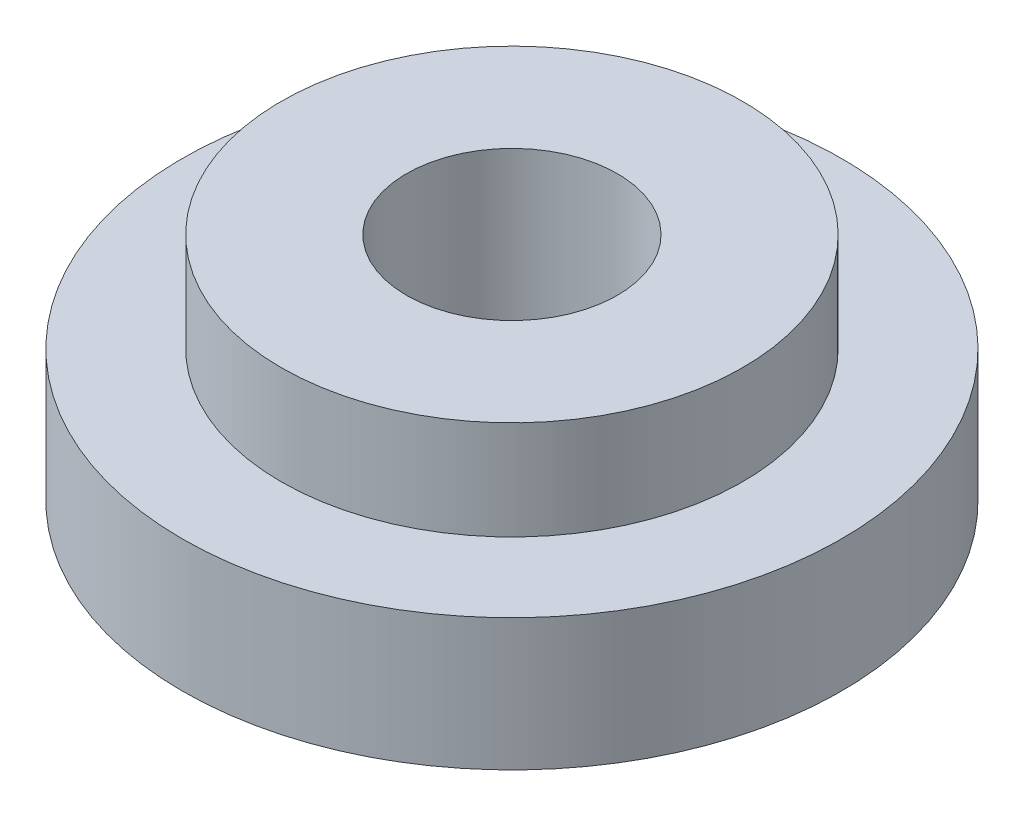
from build123d import *

# Parameters (mm, degrees)
SKETCH1_R           = 5
BOSS_EXTRUDE1_DEPTH = 2
SKETCH2_R           = 3.5
BOSS_EXTRUDE2_DEPTH = 1.5
SKETCH3_R           = 1.6
CUT_EXTRUDE1_DEPTH  = 8.889866919


with BuildPart() as part:
    # Sketch1 → Boss-Extrude1 (new body)
    with BuildSketch(Plane(origin=(0, 0, 0), x_dir=(1, 0, 0), z_dir=(0, 1, 0))):
        Circle(SKETCH1_R)
    extrude(amount=BOSS_EXTRUDE1_DEPTH)

    # Sketch2 → Boss-Extrude2 (add)
    with BuildSketch(Plane(origin=(0, 2, 0), x_dir=(1, 0, 0), z_dir=(0, 1, 0))):
        Circle(SKETCH2_R)
    extrude(amount=BOSS_EXTRUDE2_DEPTH)

    # Sketch3 → Cut-Extrude1 (cut, through all)
    with BuildSketch(Plane(origin=(0, 3.5, 0), x_dir=(1, 0, 0), z_dir=(0, 1, 0))):
        Circle(SKETCH3_R)
    extrude(amount=-CUT_EXTRUDE1_DEPTH, mode=Mode.SUBTRACT)


solid = part.part
